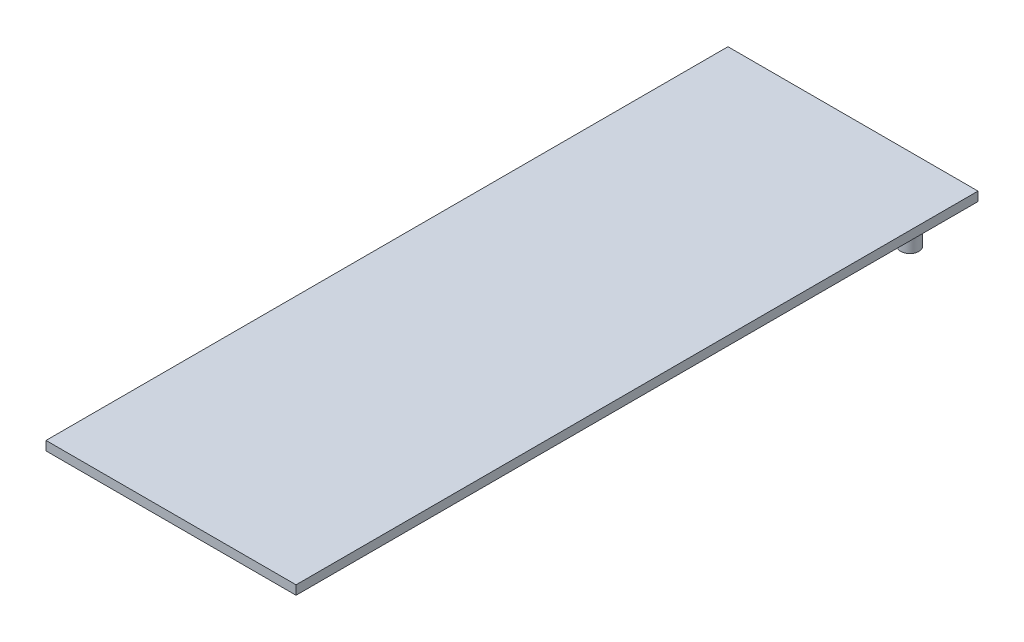
from build123d import *

# Parameters (mm, degrees)
SKETCH1_R             = 2
BOSS_EXTRUDE1_DEPTH   = 6
BOSS_EXTRUDE1_2_DEPTH = 6
SKETCH2_W             = 110
SKETCH2_H             = 150
BOSS_EXTRUDE2_DEPTH   = 2
SKETCH3_W             = 396.970470352
SKETCH3_H             = 195.408114245
CUT_EXTRUDE1_DEPTH    = 151.535710049


with BuildPart() as part:
    # Sketch1 → Boss-Extrude1 (new body)
    with BuildSketch(Plane(origin=(0, 0, 0), x_dir=(1, 0, 0), z_dir=(0, 1, 0))):
        with Locations((-50, 0)):
            Circle(SKETCH1_R)
    extrude(amount=-BOSS_EXTRUDE1_DEPTH)



with BuildPart() as body_2:
    # Sketch1 → Boss-Extrude1 2 (new body)
    with BuildSketch(Plane(origin=(0, 0, 0), x_dir=(1, 0, 0), z_dir=(0, 1, 0))):
        with Locations((50, 0)):
            Circle(SKETCH1_R)
    extrude(amount=-BOSS_EXTRUDE1_2_DEPTH)


with BuildPart() as part_1:
    add(part.part)

    add(body_2.part)  # Boss-Extrude2 merges body 2
    # Sketch2 → Boss-Extrude2 (add)
    with BuildSketch(Plane(origin=(0, 0, 0), x_dir=(1, 0, 0), z_dir=(0, 1, 0))):
        with Locations((0, -65)):
            Rectangle(SKETCH2_W, SKETCH2_H)
    extrude(amount=BOSS_EXTRUDE2_DEPTH)

    # Sketch3 → Cut-Extrude1 (cut, through all)
    with BuildSketch(Plane(origin=(0, 0, 0), x_dir=(0, 0, -1), z_dir=(1, 0, 0))):
        with Locations((-76.460247909, 9.528805424)):
            Rectangle(SKETCH3_W, SKETCH3_H)
    extrude(amount=-CUT_EXTRUDE1_DEPTH, mode=Mode.SUBTRACT)


solid = part_1.part
